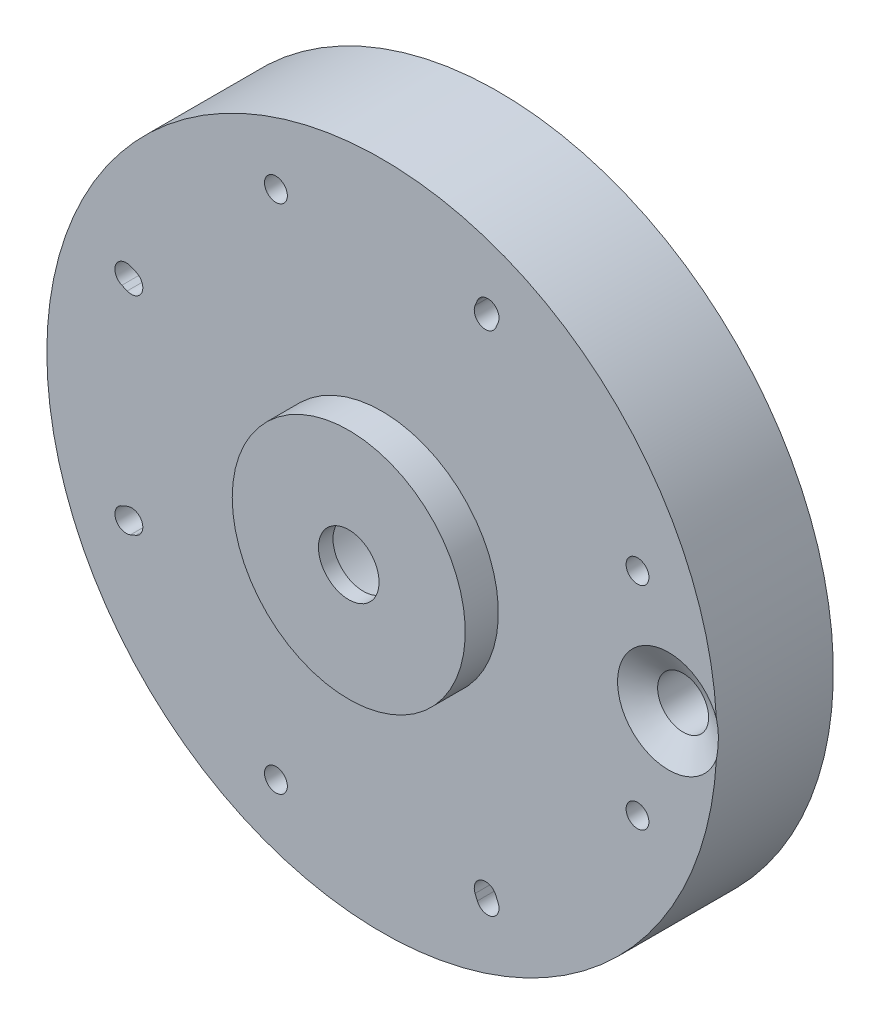
from build123d import *

# Parameters (mm, degrees)
CUT_EXTRUDE1_START                   = 4.2164
SKETCH18_R                           = 57.15
CUT_EXTRUDE1_DEPTH                   = 4.2164
F_11_32_0_34375_DIAMETER_HOLE1_D     = 8.73125
F_11_32_0_34375_DIAMETER_HOLE1_DEPTH = 76.2
F_11_32_0_34375_DIAMETER_HOLE1_TIP   = 2.62313214
PIPE_TAP_DRILL_FOR_3_8_TAP2_D        = 14.2748
PIPE_TAP_DRILL_FOR_3_8_TAP2_DEPTH    = 14.761417418
PIPE_TAP_DRILL_FOR_3_8_TAP2_TIP      = 4.288582582
F_10_CLEARANCE_HOLE1_D               = 4.9784
CIRPATTERN1_COUNT                    = 8
CLEARANCING_START                    = -4.2164
SKETCH32_R                           = 73.025
CLEARANCING_DEPTH                    = 4.2164
F_10_START                           = 4.2164
F_10_0_1935_DIAMETER_SLOT1_DEPTH     = 25.4
CIRPATTERN2_COUNT                    = 8


# Read off the part's stored shape, not the designer's step: #10 (0.1935) Diameter Slot1
with BuildPart() as part:
    # Sketch25 → Revolve1 (revolve)
    with BuildSketch(Plane(origin=(0, 0, 0), x_dir=(1, 0, 0), z_dir=(0, 1, 0))):
        Polygon((-19.558, -21.48), (-19.558, -10.24382), (-39.2684, -10.24382), (-39.2684, 0), (-57.15, 0), (-57.15, -4.2164), (-73.025, -4.2164), (-73.025, -29.6164), (-25.4, -29.6164), (-25.4, -36.83), (-6.604, -36.83), (-6.604, -33.655), (-11.1125, -33.655), (-11.1125, -30.48), (-15, -30.48), (-15, -21.48), align=None)
    revolve(axis=Axis((0, 0, -8.4836), (0, 0, 1)))

    # Sketch18 → Cut-Extrude1 (cut)
    with BuildSketch(Plane.XY.offset(CUT_EXTRUDE1_START)):
        Circle(SKETCH18_R)
        with BuildLine():
            add(Edge.make_bspline(
                [(41.089237213, 0), (41.091962531, -0.086157587), (41.097413749, -0.258491166), (41.10355964, -0.517077072), (41.10820678, -0.775748178), (41.11421023, -1.293415642), (41.109015311, -2.589274196), (41.017814103, -4.490313926), (40.7831208, -6.729807087), (40.462314107, -8.787506492), (40.037808727, -10.829994254), (39.510298345, -12.852043551), (38.880746853, -14.848458078), (38.15038378, -16.814086746), (37.320701547, -18.743836999), (36.393451781, -20.63268838), (35.370641466, -22.475705706), (34.254528452, -24.268052099), (33.047616433, -26.005001751), (31.752649319, -27.681952446), (30.372605018, -29.294437787), (28.910688618, -30.83813911), (27.370324987, -32.308897058), (25.755150794, -33.702722776), (24.069005972, -35.015808715), (22.315924639, -36.244539), (20.500125495, -37.385499343), (18.62600172, -38.435486481), (16.698110388, -39.3915171), (14.721161433, -40.250836227), (12.700006186, -41.010925075), (10.639625512, -41.669508306), (8.545117571, -42.224560694), (6.421685244, -42.674313186), (4.274623243, -43.017258312), (2.109304944, -43.252154961), (-0.068831028, -43.378032487), (-2.254294428, -43.394194133), (-4.441557201, -43.300219785), (-6.625067428, -43.095968006), (-8.799263397, -42.781577389), (-10.958587737, -42.35746718), (-13.097501591, -41.8243372), (-15.210498799, -41.183167044), (-17.292120038, -40.435214565), (-19.336966901, -39.582013644), (-21.339715858, -38.62537124), (-23.295132091, -37.567363743), (-25.198083132, -36.410332623), (-27.043552306, -35.156879378), (-28.826651909, -33.809859817), (-30.542636113, -32.372377659), (-32.186913551, -30.847777489), (-33.75505955, -29.239637062), (-35.242827981, -27.551758997), (-36.6461627, -25.788161864), (-37.961208531, -23.953070684), (-39.184321792, -22.050906876), (-40.312080298, -20.086277666), (-41.34129285, -18.063964982), (-42.269008156, -15.988913871), (-43.092523175, -13.866220454), (-43.809390856, -11.701119456), (-44.417427247, -9.498971339), (-44.914717965, -7.265249075), (-45.299623986, -5.005524575), (-45.570786769, -2.725454833), (-45.727132667, -0.430767795), (-45.767876634, 1.872751999), (-45.692525205, 4.179277959), (-45.500878745, 6.482956161), (-45.193032951, 8.777920163), (-44.76937961, 11.058305925), (-44.2306066, 13.318266753), (-43.577697135, 15.551988265), (-42.811928261, 17.753703317), (-41.934868588, 19.917706858), (-40.948375273, 22.038370685), (-39.854590259, 24.110158043), (-38.655935769, 26.127638043), (-37.35510908, 28.085499861), (-35.95507656, 29.978566677), (-34.45906702, 31.801809315), (-32.870564351, 33.550359561), (-31.193299507, 35.2195231), (-29.431241811, 36.804792072), (-27.58858964, 38.301857174), (-25.669760482, 39.706619311), (-23.67938041, 41.015200739), (-21.62227298, 42.22395569), (-19.503447594, 43.329480427), (-17.328087349, 44.32862273), (-15.101536401, 45.218490759), (-12.829286876, 45.996461288), (-10.51696536, 46.660187279), (-8.170319005, 47.207604779), (-5.795201275, 47.63693911), (-3.397557376, 47.946710349), (-0.983409407, 48.13573807), (1.441158736, 48.203145338), (3.870016668, 48.148361942), (6.297002983, 47.971126851), (8.715940862, 47.671489899), (11.120653763, 47.249812672), (13.504981164, 46.706768607), (15.862794321, 46.043342297), (18.188011992, 45.260827993), (20.47461609, 44.360827321), (22.71666723, 43.345246195), (24.908320125, 42.216290953), (27.043838787, 40.976463712), (29.117611505, 39.628556947), (31.12416555, 38.175647316), (33.058181574, 36.621088743), (34.914507669, 34.968504765), (36.688173034, 33.221780166), (38.374401232, 31.385051924), (39.968622994, 29.462699478), (41.466488529, 27.459334348), (42.863879321, 25.37978913), (44.156919368, 23.229105887), (45.341985843, 21.012523976), (46.415719137, 18.735467323), (47.152873419, 16.943563677), (47.537044371, 15.914838228), (47.625380995, 15.672606956)],
                knots=[0, 0, 0, 0, 0.000898736, 0.001797664, 0.002696784, 0.003596095, 0.007195255, 0.016206602, 0.023429565, 0.030664921, 0.03791271, 0.04517297, 0.052445735, 0.059731037, 0.067028905, 0.074339368, 0.081662453, 0.088998186, 0.096346593, 0.103707696, 0.111081519, 0.118468084, 0.125867414, 0.13327953, 0.140704451, 0.148142199, 0.155592793, 0.163056252, 0.170532595, 0.178021841, 0.185524007, 0.193039111, 0.200567171, 0.208108204, 0.215662226, 0.223229255, 0.230809306, 0.238402396, 0.24600854, 0.253627754, 0.261260054, 0.268905454, 0.27656397, 0.284235617, 0.291920409, 0.29961836, 0.307329485, 0.315053798, 0.322791313, 0.330542044, 0.338306004, 0.346083208, 0.353873668, 0.361677398, 0.369494411, 0.37732472, 0.385168337, 0.393025277, 0.400895551, 0.408779172, 0.416676152, 0.424586504, 0.432510241, 0.440447374, 0.448397915, 0.456361877, 0.464339271, 0.472330109, 0.480334403, 0.488352164, 0.496383405, 0.504428136, 0.512486369, 0.520558115, 0.528643386, 0.536742193, 0.544854546, 0.552980457, 0.561119937, 0.569272997, 0.577439648, 0.585619899, 0.593813763, 0.60202125, 0.61024237, 0.618477134, 0.626725552, 0.634987634, 0.643263392, 0.651552835, 0.659855974, 0.668172818, 0.676503379, 0.684847665, 0.693205688, 0.701577457, 0.709962981, 0.718362272, 0.726775338, 0.73520219, 0.743642837, 0.752097289, 0.760565555, 0.769047646, 0.777543571, 0.786053339, 0.79457696, 0.803114443, 0.811665798, 0.820231034, 0.828810161, 0.837403187, 0.846010122, 0.854630975, 0.863265756, 0.871914473, 0.880577136, 0.889253753, 0.897944334, 0.906648887, 0.915367423, 0.924099948, 0.932846474, 0.941607007, 0.944295232, 0.944295232, 0.944295232, 0.944295232], degree=3))
            ThreePointArc((47.625380995, 15.672606956), (47.687720846, 10.629001226), (44.585991464, 6.651424093))
            ThreePointArc((44.585991464, 6.651424093), (41.960682048, 3.786728615), (41.089237213, 0))
        make_face(mode=Mode.SUBTRACT)
    extrude(amount=-CUT_EXTRUDE1_DEPTH, mode=Mode.SUBTRACT)

    # 11/32 (0.34375) Diameter Hole1
    with Locations(Plane(origin=(-73.025, 0, 18.5039), x_dir=(0, 0, -1), z_dir=(-1, 0, 0))):
        with Locations((0, 0)):
            Hole(F_11_32_0_34375_DIAMETER_HOLE1_D / 2, depth=F_11_32_0_34375_DIAMETER_HOLE1_DEPTH)
            with Locations((0, 0, -(F_11_32_0_34375_DIAMETER_HOLE1_DEPTH + F_11_32_0_34375_DIAMETER_HOLE1_TIP / 2))):  # 118° drill point
                Cone(0, F_11_32_0_34375_DIAMETER_HOLE1_D / 2, F_11_32_0_34375_DIAMETER_HOLE1_TIP, mode=Mode.SUBTRACT)

    # Sketch20 one side → Turbine Shaft Hole (revolve, cut)
    with BuildSketch(Plane(origin=(0, 0, 0), x_dir=(1, 0, 0), z_dir=(0, 1, 0)), mode=Mode.PRIVATE) as turbine_shaft_hole_sk:
        Polygon((56.94375, -26.4414), (51.3875, -29.6164), (62.5, -29.6164), (62.5, -4.2164), (56.94375, -4.2164), align=None)
    revolve(turbine_shaft_hole_sk.sketch.rotate(Axis((62.5, 0, 29.6164), (0, 0, -1)), 180), axis=Axis((62.5, 0, 29.6164), (0, 0, -1)), mode=Mode.SUBTRACT)

    # Pipe Tap Drill for 3/8 Tap2
    with Locations(Plane(origin=(-73.025, 0, 18.5039), x_dir=(0, 0, -1), z_dir=(-1, 0, 0))):
        with Locations((0, 0)):
            Hole(PIPE_TAP_DRILL_FOR_3_8_TAP2_D / 2, depth=PIPE_TAP_DRILL_FOR_3_8_TAP2_DEPTH)
            with Locations((0, 0, -(PIPE_TAP_DRILL_FOR_3_8_TAP2_DEPTH + PIPE_TAP_DRILL_FOR_3_8_TAP2_TIP / 2))):  # 118° drill point
                Cone(0, PIPE_TAP_DRILL_FOR_3_8_TAP2_D / 2, PIPE_TAP_DRILL_FOR_3_8_TAP2_TIP, mode=Mode.SUBTRACT)

    # #10 Clearance Hole1 (through all)
    with Locations(Plane(origin=(55.733032799, -23.085378057, 29.6164), x_dir=(1, 0, 0), z_dir=(0, 0, 1))):
        with Locations((0, 0)):
            f_10_clearance_hole1 = Hole(F_10_CLEARANCE_HOLE1_D / 2)

    # CirPattern1: #10 Clearance Hole1 ×8 about axis, 4 skipped
    cirpattern1_axis = Axis((0, 0, 0), (0, 0, 1))
    add([f_10_clearance_hole1.rotate(cirpattern1_axis, i * 360 / CIRPATTERN1_COUNT) for i in range(1, CIRPATTERN1_COUNT) if i not in (2, 4, 5, 7)], mode=Mode.SUBTRACT)

    # Sketch32 → Clearancing (cut)
    with BuildSketch(Plane(origin=(0, 0, 0), x_dir=(-1, 0, 0), z_dir=(0, 0, -1)).offset(CLEARANCING_START)):
        Circle(SKETCH32_R)
        with BuildLine():
            ThreePointArc((-47.506067229, 15.629095748), (-47.567368082, 10.669550114), (-44.51733419, 6.758265932))
            ThreePointArc((-44.51733419, 6.758265932), (-41.848269617, 3.845825531), (-40.962300701, -0.004015228))
            add(Edge.make_bspline(
                [(-40.962300701, -0.004015228), (-40.984829754, -0.716243545), (-40.991482345, -1.426292399), (-40.965808515, -2.841039211), (-40.934791994, -3.545916987), (-40.788046598, -5.65317915), (-40.449416827, -8.44323574), (-39.826992242, -11.194334019), (-39.251228801, -13.242702158), (-39.04041264, -13.924921757), (-38.586043887, -15.271416492), (-38.342460818, -15.936244836), (-37.044241995, -19.219159068), (-35.751111298, -21.714802599), (-33.817948717, -24.671739224), (-33.415325439, -25.254916955), (-32.577512865, -26.404553153), (-32.142989691, -26.969901223), (-30.805310798, -28.622109954), (-29.863742521, -29.67138319), (-27.88370287, -31.668321975), (-26.84522274, -32.615978344), (-25.214580249, -33.961000268), (-24.658855428, -34.396572383), (-23.52273746, -35.241850655), (-22.941371199, -35.652200602), (-19.982337143, -37.630798215), (-17.495723306, -38.952149767), (-13.594391809, -40.558687212), (-12.265158452, -41.031133778), (-10.227142901, -41.643055288), (-9.538560062, -41.831284287), (-8.159344959, -42.171675018), (-7.468051402, -42.324142065), (-4.003321953, -42.999606071), (-1.205332292, -43.264420661), (2.324696242, -43.253266134), (3.032343885, -43.233770306), (4.450976737, -43.159684207), (5.16260658, -43.104918353), (7.279359647, -42.889714494), (8.673993393, -42.678265993), (12.809724164, -41.845880015), (15.503095197, -41.028729387), (18.787939685, -39.670706521), (19.439945622, -39.382349429), (20.721782261, -38.777972555), (21.353348612, -38.461258619), (23.220466367, -37.468277477), (25.636538884, -36.03026989), (27.907728904, -34.367230475), (29.556019298, -33.034366172), (30.096251631, -32.575792031), (31.157992098, -31.629561277), (31.678275818, -31.142874487), (34.206194586, -28.662350465), (36.015531715, -26.510793678), (38.41831625, -23.039245987), (39.16701973, -21.841083162), (40.20957198, -19.98066895), (40.543029676, -19.350876534), (41.176251076, -18.083381709), (41.476896624, -17.444132119), (42.901648241, -14.220838418), (43.792349276, -11.556354365), (44.594692676, -8.118555948), (44.739484647, -7.425593495), (44.997193357, -6.028683216), (45.110048425, -5.324423569), (45.397284161, -3.217220036), (45.521950193, -1.812522973), (45.701086012, 2.401261181), (45.562340657, 5.210043831), (45.059447785, 8.720503026), (44.941902272, 9.424175437), (44.675570213, 10.818485677), (44.526710242, 11.510176401), (44.03392467, 13.569160455), (43.253850892, 16.271636591), (42.232110927, 18.889968175), (41.374523909, 20.821933821), (41.073427004, 21.460617921), (40.440358133, 22.727235888), (40.107694699, 23.35639756), (38.373818129, 26.460390162), (36.780750271, 28.78088885), (34.095328382, 32.027965174), (33.150564893, 33.07112628), (31.657831232, 34.576159768), (31.147637834, 35.06787246), (30.101580295, 36.031020228), (29.567134533, 36.501054535), (26.856787595, 38.778313639), (24.550582917, 40.384325472), (20.890041552, 42.47849974), (19.636115903, 43.123761403), (17.703471684, 44.01067886), (17.048967242, 44.293434078), (15.733188711, 44.827093949), (15.071549163, 45.078271992), (11.744943292, 46.257335392), (9.025190072, 46.956566279), (4.859147554, 47.644767103), (3.455979938, 47.813706456), (1.328883106, 47.973856364), (0.6186853, 48.011419961), (-0.796199225, 48.054972454), (-1.502092621, 48.06105803), (-5.023934167, 48.014237149), (-7.817182412, 47.731371248), (-11.278596108, 47.072391218), (-11.96936046, 46.925213328), (-13.347812594, 46.599690607), (-14.03708102, 46.420880282), (-16.087853103, 45.84036778), (-17.428630402, 45.396086399), (-21.374271765, 43.89689302), (-23.903005899, 42.67684778), (-26.936352555, 40.875077272), (-27.536597899, 40.500788916), (-28.724048455, 39.723926887), (-29.311972723, 39.320747942), (-31.039486686, 38.080104884), (-32.148213344, 37.208324215), (-35.349169758, 34.462697204), (-37.317082683, 32.459509238), (-39.567440801, 29.737522075), (-40.006964214, 29.18215008), (-40.86456786, 28.049096194), (-41.281778161, 27.472452922), (-42.490525828, 25.724130807), (-43.242666913, 24.529670436), (-45.341238448, 20.861286589), (-46.530959758, 18.302975659), (-47.506067229, 15.629095748)],
                knots=[0, 0, 0, 0, 0.0078125, 0.0078125, 0.015625, 0.015625, 0.03125, 0.046875, 0.046875, 0.0546875, 0.0546875, 0.0625, 0.0625, 0.09375, 0.09375, 0.1015625, 0.1015625, 0.109375, 0.109375, 0.125, 0.125, 0.140625, 0.140625, 0.1484375, 0.1484375, 0.15625, 0.15625, 0.1875, 0.1875, 0.203125, 0.203125, 0.2109375, 0.2109375, 0.21875, 0.21875, 0.25, 0.25, 0.2578125, 0.2578125, 0.265625, 0.265625, 0.28125, 0.28125, 0.3125, 0.3125, 0.3203125, 0.3203125, 0.328125, 0.328125, 0.34375, 0.359375, 0.359375, 0.3671875, 0.3671875, 0.375, 0.375, 0.40625, 0.40625, 0.421875, 0.421875, 0.4296875, 0.4296875, 0.4375, 0.4375, 0.46875, 0.46875, 0.4765625, 0.4765625, 0.484375, 0.484375, 0.5, 0.5, 0.53125, 0.53125, 0.5390625, 0.5390625, 0.546875, 0.546875, 0.5625, 0.578125, 0.578125, 0.5859375, 0.5859375, 0.59375, 0.59375, 0.625, 0.625, 0.640625, 0.640625, 0.6484375, 0.6484375, 0.65625, 0.65625, 0.6875, 0.6875, 0.703125, 0.703125, 0.7109375, 0.7109375, 0.71875, 0.71875, 0.75, 0.75, 0.765625, 0.765625, 0.7734375, 0.7734375, 0.78125, 0.78125, 0.8125, 0.8125, 0.8203125, 0.8203125, 0.828125, 0.828125, 0.84375, 0.84375, 0.875, 0.875, 0.8828125, 0.8828125, 0.890625, 0.890625, 0.90625, 0.90625, 0.9375, 0.9375, 0.9453125, 0.9453125, 0.953125, 0.953125, 0.96875, 0.96875, 1, 1, 1, 1], degree=3))
        make_face(mode=Mode.SUBTRACT)
    extrude(amount=CLEARANCING_DEPTH, mode=Mode.SUBTRACT)

    # #10 (0.1935) Diameter Slot1 outline → #10 (0.1935) Diameter Slot1 (cut)
    with BuildSketch(Plane.XY.offset(F_10_START)):
        with BuildLine():
            ThreePointArc((20.8149903, -56.6734582), (24.025803458, -58.003420556), (25.355765815, -54.792607398))
            Line((25.355765815, -54.792607398), (24.869757855, -53.619280392))
            ThreePointArc((24.869757855, -53.619280392), (21.658944697, -52.289318035), (20.328982341, -55.500131193))
            Line((20.328982341, -55.500131193), (20.8149903, -56.6734582))
        make_face()
    f_10_0_1935_diameter_slot1 = extrude(amount=F_10_0_1935_DIAMETER_SLOT1_DEPTH, mode=Mode.SUBTRACT)

    # CirPattern2: #10 (0.1935) Diameter Slot1 ×8 about axis, 4 skipped
    cirpattern2_axis = Axis((0, 0, -50.361336866), (0, 0, 1))
    add([f_10_0_1935_diameter_slot1.rotate(cirpattern2_axis, i * 360 / CIRPATTERN2_COUNT) for i in range(1, CIRPATTERN2_COUNT) if i not in (1, 2, 4, 7)], mode=Mode.SUBTRACT)


solid = part.part
